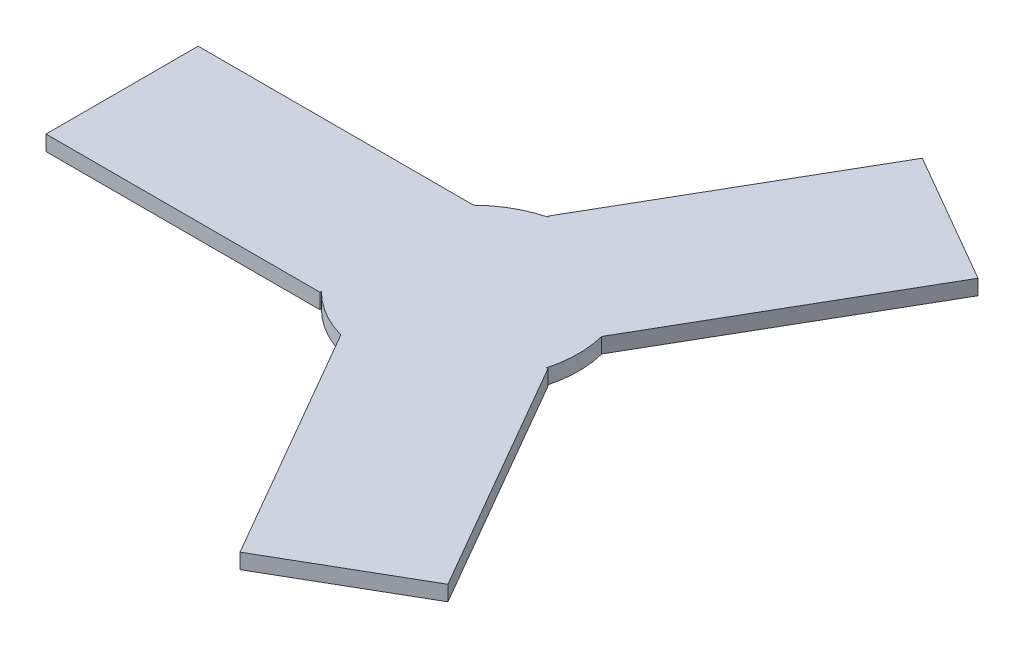
from build123d import *

# Parameters (mm, degrees)
BOSS_EXTRU_3_DEPTH = 5


with BuildPart() as part:
    # Esquisse3 → Boss.-Extru.3 (new body)
    with BuildSketch(Plane(origin=(0, 0, 0), x_dir=(1, 0, 0), z_dir=(0, 1, 0))):
        with BuildLine():
            Line((-115, -25), (-25, -25))
            Line((-25, -25), (-24.99494949, -24.500051021))
            ThreePointArc((-24.99494949, -24.500051021), (-17.805293657, -30.132565736), (-9.403186381, -33.713203436))
            Line((-9.403186381, -33.713203436), (35.849364905, -112.092921435))
            Line((35.849364905, -112.092921435), (79.150635095, -87.092921435))
            Line((79.150635095, -87.092921435), (34.150635095, -9.150635095))
            Line((34.150635095, -9.150635095), (33.715141323, -9.396235714))
            ThreePointArc((33.715141323, -9.396235714), (34.998214236, -0.353553761), (33.898083809, 8.713203436))
            Line((33.898083809, 8.713203436), (79.150635095, 87.092921435))
            Line((79.150635095, 87.092921435), (35.849364905, 112.092921435))
            Line((35.849364905, 112.092921435), (-9.150635095, 34.150635095))
            Line((-9.150635095, 34.150635095), (-8.720191833, 33.896286735))
            ThreePointArc((-8.720191833, 33.896286735), (-17.19292058, 30.486119496), (-24.494897428, 25))
            Line((-24.494897428, 25), (-115, 25))
            Line((-115, 25), (-115, -25))
        make_face()
    extrude(amount=BOSS_EXTRU_3_DEPTH)


solid = part.part
